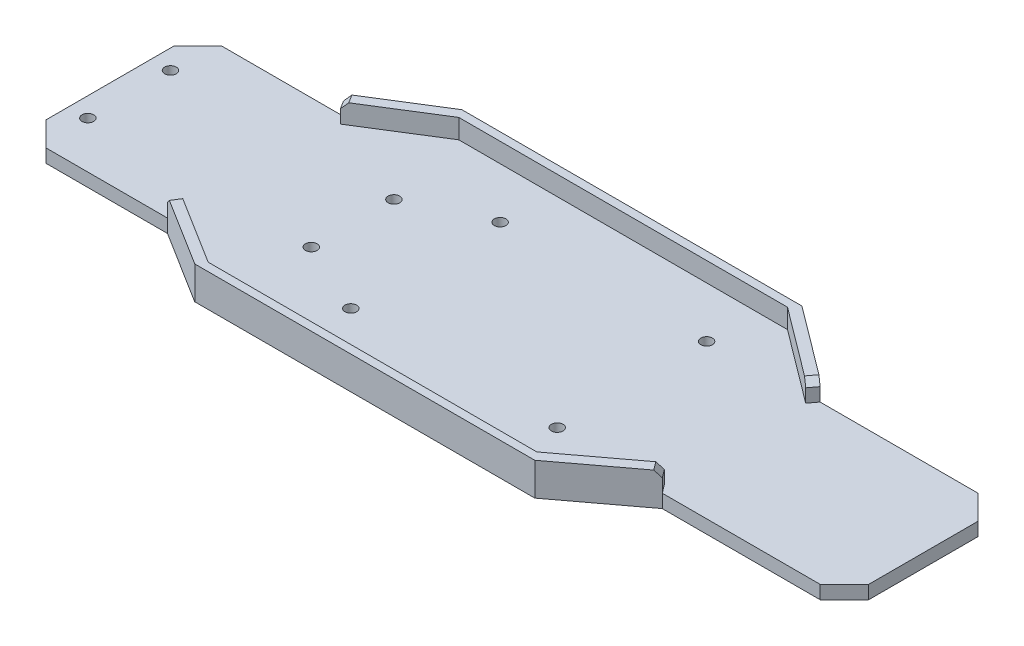
from build123d import *

# Parameters (mm, degrees)
BOSS_EXTRUDE1_DEPTH  = 5.5
CHASSIS_WALLS1_DEPTH = 8
CHAMFER1_SIZE        = 10
CHAMFER2_SIZE        = 10
CHAMFER3_SIZE        = 2.5
SKETCH4_R            = 2.4
CUT_EXTRUDE1_DEPTH   = 10


with BuildPart() as part:
    # Sketch1 → Boss-Extrude1 (new body)
    with BuildSketch(Plane(origin=(0, 0, 0), x_dir=(1, 0, 0), z_dir=(0, 1, 0))):
        Polygon((-100, 36.25), (-70, 55), (70, 55), (100, 32.5), (175, 32.5), (175, -32.5), (100, -32.5), (70, -55), (-70, -55), (-100, -36.25), (-160, -36.25), (-160, 36.25), align=None)
    extrude(amount=BOSS_EXTRUDE1_DEPTH)

    # Sketch3 → Chassis-Walls1 (add)
    with BuildSketch(Plane(origin=(0, 5.5, 0), x_dir=(1, 0, 0), z_dir=(0, 1, 0))):
        Polygon((0, 55), (-70, 55), (-100, 36.25), (-97.88000424, 32.858006784), (-67.88000424, 51.608006784), (0, 51.608006784), (67.456005088, 51.608006784), (97.456005088, 29.108006784), (100, 32.5), (70, 55), align=None)
        Polygon((67.456005088, -51.608006784), (0, -51.608006784), (-67.88000424, -51.608006784), (-97.88000424, -32.858006784), (-100, -36.25), (-70, -55), (0, -55), (70, -55), (100, -32.5), (97.456005088, -29.108006784), align=None)
    extrude(amount=CHASSIS_WALLS1_DEPTH)

    # Chamfer1
    chamfer1_edges = [part.edges().sort_by_distance(p)[0] for p in [
        (-160, 2.75, -36.25),
        (-160, 2.75, 36.25),
    ]]
    chamfer(chamfer1_edges, length=CHAMFER1_SIZE)

    # Chamfer2
    chamfer2_edges = [part.edges().sort_by_distance(p)[0] for p in [
        (175, 2.75, -32.5),
        (175, 2.75, 32.5),
    ]]
    chamfer(chamfer2_edges, length=CHAMFER2_SIZE)

    # Chamfer3
    chamfer3_edges = [part.edges().sort_by_distance(p)[0] for p in [
        (-98.94000212, 13.5, -34.554003392),
        (-98.94000212, 13.5, 34.554003392),
        (98.728002544, 13.5, 30.804003392),
        (98.728002544, 13.5, -30.804003392),
    ]]
    chamfer(chamfer3_edges, length=CHAMFER3_SIZE)

    # Sketch4 → Cut-Extrude1 (cut)
    with BuildSketch(Plane.XZ):
        with Locations((-152, 17)):
            Circle(SKETCH4_R)
        with Locations((-60, 17)):
            Circle(SKETCH4_R)
        with Locations((-60, -17)):
            Circle(SKETCH4_R)
        with Locations((-152, -17)):
            Circle(SKETCH4_R)
        with Locations((-30, 30.75)):
            Circle(SKETCH4_R)
        with Locations((55, 30.75)):
            Circle(SKETCH4_R)
        with Locations((55, -30.75)):
            Circle(SKETCH4_R)
        with Locations((-30, -30.75)):
            Circle(SKETCH4_R)
    extrude(amount=-CUT_EXTRUDE1_DEPTH, mode=Mode.SUBTRACT)


solid = part.part
